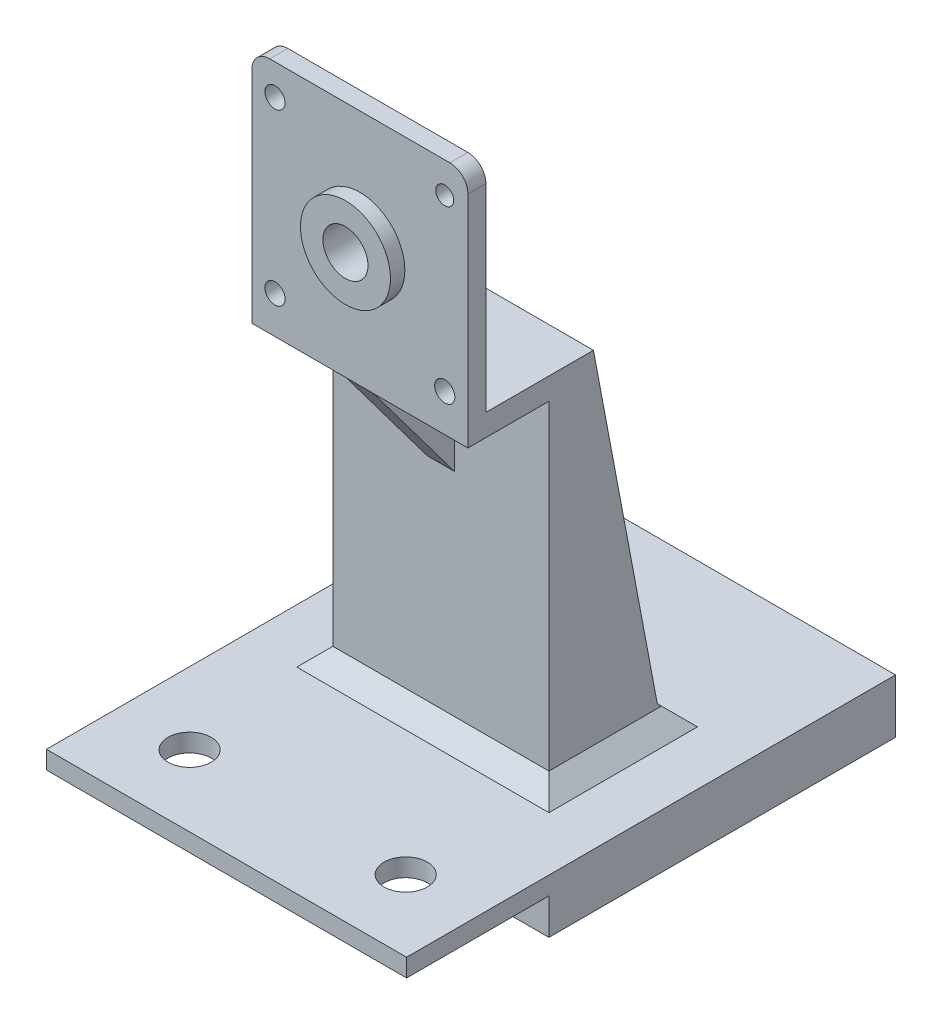
from build123d import *
from OCP.BRepFilletAPI import BRepFilletAPI_MakeChamfer
from build123d.topology import SkipClean

# Parameters (mm, degrees)
SKETCH_1_W               = 150
SKETCH_1_H               = 150
EXTRUDE_1_DEPTH          = 20
SKETCH_2_W               = 200
SKETCH_2_H               = 170
EXTRUDE_2_DEPTH          = 20
SKETCH_3_W               = 200
SKETCH_3_H               = 22.5
EXTRUDE_3_DEPTH          = 20
SKETCH_4_W               = 200
SKETCH_4_H               = 101.536616744
SKETCH_4_R               = 12
EXTRUDE_4_DEPTH          = 10
SKETCH_5_W               = 200
SKETCH_5_H               = 170
EXTRUDE_5_DEPTH          = 10
SKETCH_6_W               = 12.361111111
SKETCH_6_H               = 120
EXTRUDE_6_DEPTH          = 60
CHAMFER_1_SIZE           = 10
CHAMFER_1_SIZE2          = 12.546778674
SKETCH_8_R               = 12.5
CUT_EXTRUDE_1_DEPTH      = 200
SKETCH_9_R               = 5.6
CUT_EXTRUDE_2_DEPTH      = 200
FILLET_1_R               = 10
SKETCH_10_R              = 40
SKETCH_10_R_2            = 8.532995409
EXTRUDE_7_DEPTH          = 5
SKETCH_11_R              = 12.5
CUT_EXTRUDE_3_DEPTH      = 200
SKETCH_12_W              = 50
SKETCH_12_H              = 12.140710291
EXTRUDE_8_DEPTH          = 120
EXTRUDE_9_DEPTH          = 120
SKETCH_14_R              = 5
SKETCH_14_R_2            = 5.6
CUT_EXTRUDE_4_DEPTH      = 200
CUT_EXTRUDE_5_DEPTH      = 428.663313117
CUT_EXTRUDE_5_DEPTH_BACK = 428.663313117
SKETCH_16_W              = 64.88929467
SKETCH_16_H              = 154.650571828
SKETCH_17_R              = 25
SKETCH_17_R_2            = 12.5
EXTRUDE_11_DEPTH         = 8
FILLET_2_R               = 10
RIB_1_REACH              = 411.018
SKETCH_18_WALL_W         = 895.028437604
SKETCH_18_WALL_H         = 15
CUT_EXTRUDE_6_DEPTH      = 425.676064177
CUT_EXTRUDE_6_DEPTH_BACK = 425.676064177
SKETCH_19_R              = 12.5


with BuildPart() as part:
    # 草图1 → 凸台-拉伸1 (new body)
    with BuildSketch(Plane(origin=(0, 0, 0), x_dir=(1, 0, 0), z_dir=(0, 1, 0))):
        Rectangle(SKETCH_1_W, SKETCH_1_H)
    extrude(amount=EXTRUDE_1_DEPTH)

    # 草图2 → 凸台-拉伸2 (add)
    with BuildSketch(Plane(origin=(0, 20, 0), x_dir=(1, 0, 0), z_dir=(0, 1, 0))):
        with Locations((-25, 0)):
            Rectangle(SKETCH_2_W, SKETCH_2_H)
    extrude(amount=-EXTRUDE_2_DEPTH)

    # 草图3 → 凸台-拉伸3 (add)
    with BuildSketch(Plane(origin=(0, 20, 0), x_dir=(1, 0, 0), z_dir=(0, 1, 0))):
        with Locations((-25, -96.25)):
            Rectangle(SKETCH_3_W, SKETCH_3_H)
    extrude(amount=-EXTRUDE_3_DEPTH)

    # 草图4 → 凸台-拉伸4 (add)
    with BuildSketch(Plane(origin=(0, 20, 0), x_dir=(1, 0, 0), z_dir=(0, 1, 0))):
        with Locations((-25, -135.768308372)):
            Rectangle(SKETCH_4_W, SKETCH_4_H)
        with Locations(Location((35, -147.018308372, 0), (0, 0, 270))):
            Circle(SKETCH_4_R, mode=Mode.SUBTRACT)
        with Locations(Location((-85, -147.018308372, 0), (0, 0, 270))):
            Circle(SKETCH_4_R, mode=Mode.SUBTRACT)
    extrude(amount=EXTRUDE_4_DEPTH)

    # 草图5 → 凸台-拉伸5 (add)
    with BuildSketch(Plane(origin=(0, 20, 0), x_dir=(1, 0, 0), z_dir=(0, 1, 0))):
        with Locations((-25, 0)):
            Rectangle(SKETCH_5_W, SKETCH_5_H)
    extrude(amount=EXTRUDE_5_DEPTH)

    # 草图6 → 凸台-拉伸6 (add, symmetric)
    with BuildSketch(Plane(origin=(-25, 0, 0), x_dir=(0, 0, -1), z_dir=(1, 0, 0))):
        Polygon((-67.5, 30), (-5, 30), (-42.777777778, 230), (-67.5, 230), align=None)
        with Locations((-61.319444445, 290)):
            Rectangle(SKETCH_6_W, SKETCH_6_H)
    extrude(amount=EXTRUDE_6_DEPTH, both=True)

    # 倒角1: one chamfer whose edges measure the first distance from different faces: ONE call of the kernel's chamfer builder (chamfer() names one face for all edges)
    chamfer_1_edges_1 = [part.edges().sort_by_distance(p)[0] for p in [
        (-85, 30, 36.25),
        (-25, 30, 67.5),
        (35, 30, 36.25),
    ]]
    chamfer_1_edges_2 = [part.edges().sort_by_distance(p)[0] for p in [
        (-25, 30, 5),
    ]]
    chamfer_1_side_2 = [part.faces().sort_by_distance(p)[0] for p in [
        (-121.627580479, 30, 50.768308372),
    ]]
    chamfer_1 = BRepFilletAPI_MakeChamfer(part.part.solid().wrapped)
    for e in chamfer_1_edges_1:
        chamfer_1.Add(CHAMFER_1_SIZE, e.wrapped)
    for e in chamfer_1_edges_2:
        chamfer_1.Add(CHAMFER_1_SIZE, CHAMFER_1_SIZE2, e.wrapped, chamfer_1_side_2[0].wrapped)  # the first distance lies on this face
    add(Compound.cast(chamfer_1.Shape()), mode=Mode.REPLACE)

    # 草图8 → 切除-拉伸1 (cut)
    with BuildSketch(Plane.XY.offset(67.5)):
        with Locations((-25, 285.8)):
            Circle(SKETCH_8_R)
    extrude(amount=-CUT_EXTRUDE_1_DEPTH, mode=Mode.SUBTRACT)

    # 草图9 → 切除-拉伸2 (cut)
    with BuildSketch(Plane.XY.offset(67.5)):
        with Locations((-72.14, 333.54)):
            Circle(SKETCH_9_R)
        with Locations((-72.14, 239.26)):
            Circle(SKETCH_9_R)
        with Locations((22.14, 239.26)):
            Circle(SKETCH_9_R)
        with Locations((22.14, 333.54)):
            Circle(SKETCH_9_R)
    extrude(amount=-CUT_EXTRUDE_2_DEPTH, mode=Mode.SUBTRACT)

    # 圆角1
    fillet_1_edges = [part.edges().sort_by_distance(p)[0] for p in [
        (35, 350, 61.319444444),
        (-85, 350, 61.319444444),
    ]]
    fillet(fillet_1_edges, radius=FILLET_1_R)

    # 草图10 → 凸台-拉伸7 (add)
    with BuildSketch(Plane.XY.offset(67.5)):
        with Locations((-25, 285.8)):
            Circle(SKETCH_10_R)
        with Locations((-25, 285.8)):
            Circle(SKETCH_10_R_2, mode=Mode.SUBTRACT)
    extrude(amount=EXTRUDE_7_DEPTH)

    # 草图11 → 切除-拉伸3 (cut)
    with BuildSketch(Plane.XY.offset(72.5)):
        with Locations((-25, 285.8)):
            Circle(SKETCH_11_R)
    extrude(amount=-CUT_EXTRUDE_3_DEPTH, mode=Mode.SUBTRACT)

    # 草图12 → 凸台-拉伸8 (add)
    with BuildSketch(Plane(origin=(35, 0, 0), x_dir=(0, 0, -1), z_dir=(1, 0, 0))):
        with Locations((-67.777777778, 223.929644855)):
            Rectangle(SKETCH_12_W, SKETCH_12_H)
    extrude(amount=-EXTRUDE_8_DEPTH)

    # 草图13 → 凸台-拉伸9 (add)
    with BuildSketch(Plane(origin=(35, 0, 0), x_dir=(0, 0, -1), z_dir=(1, 0, 0))):
        Polygon((-92.777777778, 230), (-102.486640647, 230), (-102.486640647, 350), (-112.486640647, 350), (-112.486640647, 230), (-112.486640647, 217.859289709), (-92.777777778, 217.859289709), align=None)
    extrude(amount=-EXTRUDE_9_DEPTH)

    # 草图14 → 切除-拉伸4 (cut)
    with BuildSketch(Plane.XY.offset(112.486640647)):
        with Locations((22.14, 332.94)):
            Circle(SKETCH_14_R)
        with Locations((22.14, 238.66)):
            Circle(SKETCH_14_R_2)
        with Locations((-72.14, 238.66)):
            Circle(SKETCH_14_R_2)
        with Locations((-72.14, 332.94)):
            Circle(SKETCH_14_R_2)
    extrude(amount=-CUT_EXTRUDE_4_DEPTH, mode=Mode.SUBTRACT)

    # 草图16 → 切除-拉伸5 (cut, two sides: drawn at the far end of the back side and taken through both)
    with BuildSketch(Plane.ZY.offset(85).offset(-CUT_EXTRUDE_5_DEPTH_BACK)):
        with Locations((49.451016332, 307.325285914)):
            Rectangle(SKETCH_16_W, SKETCH_16_H)
    extrude(amount=CUT_EXTRUDE_5_DEPTH + CUT_EXTRUDE_5_DEPTH_BACK, mode=Mode.SUBTRACT)

    # 草图17 → 凸台-拉伸11 (add)
    with BuildSketch(Plane.XY.offset(112.486640647)):
        with Locations((-24.999999135, 285.832995409)):
            Circle(SKETCH_17_R)
        with Locations((-24.999999135, 285.832995409)):
            Circle(SKETCH_17_R_2, mode=Mode.SUBTRACT)
    extrude(amount=EXTRUDE_11_DEPTH)

    # 圆角2
    fillet_2_edges = [part.edges().sort_by_distance(p)[0] for p in [
        (35, 350, 107.486640647),
        (-85, 350, 107.486640647),
    ]]
    fillet(fillet_2_edges, radius=FILLET_2_R)

    # 草图18 wall → 筋1 (add, up to next)
    with BuildSketch(Plane(origin=(-25, 187.859289709, 89.993320324), x_dir=(0, -0.800085500873, -0.599885981911), z_dir=(0, 0.599885981911, -0.800085500873)), mode=Mode.PRIVATE) as rib_1_sk1:
        Rectangle(SKETCH_18_WALL_W, SKETCH_18_WALL_H)
    rib_1_tool1 = extrude(rib_1_sk1.sketch, amount=RIB_1_REACH, mode=Mode.PRIVATE) - part.part
    add(rib_1_tool1.solids().sort_by_distance((-25, 187.859289709, 89.993320324))[0])

    # 草图19 → 切除-拉伸6 (cut, two sides: drawn at the far end of the back side and taken through both)
    with SkipClean():  # the faces are left unmerged after this step: merging them gives an invalid solid
        with BuildSketch(Plane.XY.offset(120.486640647).offset(-CUT_EXTRUDE_6_DEPTH_BACK)):
            with Locations(Location((-24.999999135, 285.832995409, 0), (0, 0, 180))):
                Circle(SKETCH_19_R)
        extrude(amount=CUT_EXTRUDE_6_DEPTH + CUT_EXTRUDE_6_DEPTH_BACK, mode=Mode.SUBTRACT)
    add(part.part.scale(1), mode=Mode.REPLACE)  # the faces are merged on a copy


solid = part.part
